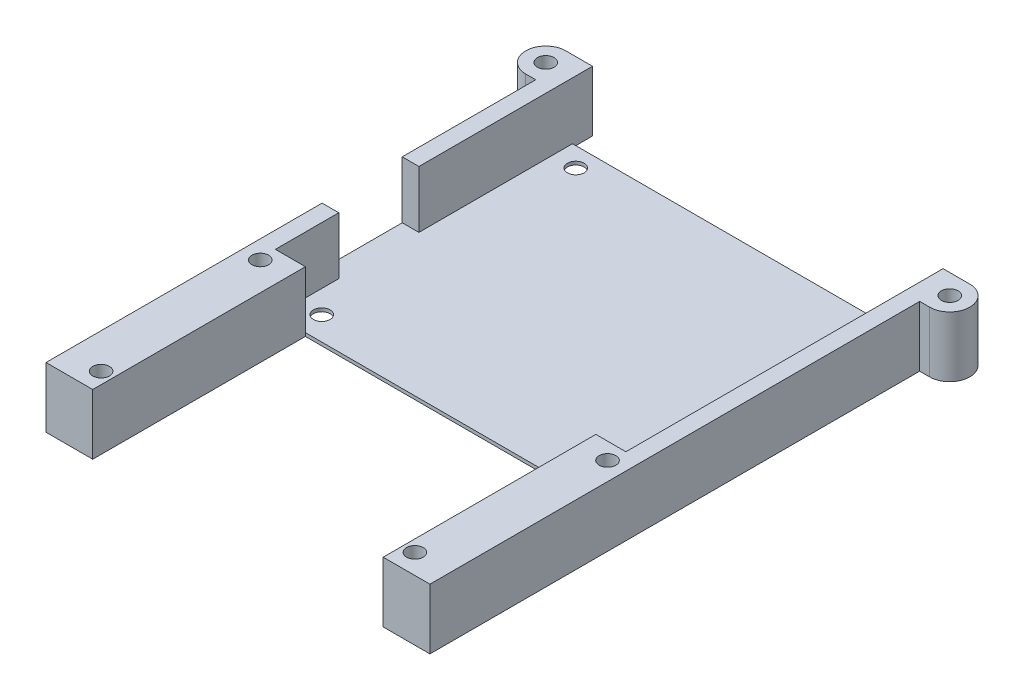
from build123d import *

# Parameters (mm, degrees)
BOSS_EXTRUDE1_DEPTH            = 0.5
BOSS_EXTRUDE2_DEPTH            = 9.05
F_2_5_2_5_DIAMETER_HOLE1_D     = 2.5
F_2_5_2_5_DIAMETER_HOLE1_DEPTH = 12
F_2_5_2_5_DIAMETER_HOLE1_TIP   = 0.751075774


with BuildPart() as part:
    # Sketch1 → Boss-Extrude1 (new body)
    with BuildSketch(Plane(origin=(0, 0, 0), x_dir=(1, 0, 0), z_dir=(0, 1, 0))):
        Polygon((26.25, 31.85), (26.25, 76.35), (-26.25, 76.35), (-26.25, 53.35), (-28.75, 53.35), (-28.75, 41.35), (-26.25, 41.35), (-26.25, 31.85), align=None)
    extrude(amount=BOSS_EXTRUDE1_DEPTH)

    # Sketch1<3> → Boss-Extrude2 (add)
    with BuildSketch(Plane(origin=(0, 0, 0), x_dir=(1, 0, 0), z_dir=(0, 1, 0))):
        with BuildLine():
            Line((-26.25, 79.35), (-30.25, 79.35))
            ThreePointArc((-30.25, 79.35), (-33.25, 76.35), (-30.25, 73.35))
            Line((-30.25, 73.35), (-28.75, 73.35))
            Line((-28.75, 73.35), (-28.75, 53.35))
            Line((-28.75, 53.35), (-26.25, 53.35))
            Line((-26.25, 53.35), (-26.25, 79.35))
        make_face()
        with BuildLine():
            Line((26.25, 79.35), (26.25, 31.85))
            Line((26.25, 31.85), (21.75, 31.85))
            Line((21.75, 31.85), (21.75, 0))
            Line((21.75, 0), (28.75, 0))
            Line((28.75, 0), (28.75, 73.35))
            Line((28.75, 73.35), (30.25, 73.35))
            ThreePointArc((30.25, 73.35), (33.25, 76.35), (30.25, 79.35))
            Line((30.25, 79.35), (26.25, 79.35))
        make_face()
        Polygon((-26.25, 31.85), (-26.25, 41.35), (-28.75, 41.35), (-28.75, 0), (-21.75, 0), (-21.75, 31.85), align=None)
    extrude(amount=BOSS_EXTRUDE2_DEPTH)

    # Ø2.5 (2.5) Diameter Hole1
    with Locations(Plane(origin=(0, 0, 0), x_dir=(-1, 0, 0), z_dir=(0, -1, 0))):
        with Locations((-22.85, 73.45), (22.85, 73.45), (26, 29.35), (22.85, 35.4), (-22.85, 35.4), (-26, 29.35), (-23.5, 3), (23.5, 3), (-30.25, 76.35), (30.25, 76.35)):
            Hole(F_2_5_2_5_DIAMETER_HOLE1_D / 2, depth=F_2_5_2_5_DIAMETER_HOLE1_DEPTH)
            with Locations((0, 0, -(F_2_5_2_5_DIAMETER_HOLE1_DEPTH + F_2_5_2_5_DIAMETER_HOLE1_TIP / 2))):  # 118° drill point
                Cone(0, F_2_5_2_5_DIAMETER_HOLE1_D / 2, F_2_5_2_5_DIAMETER_HOLE1_TIP, mode=Mode.SUBTRACT)


solid = part.part
